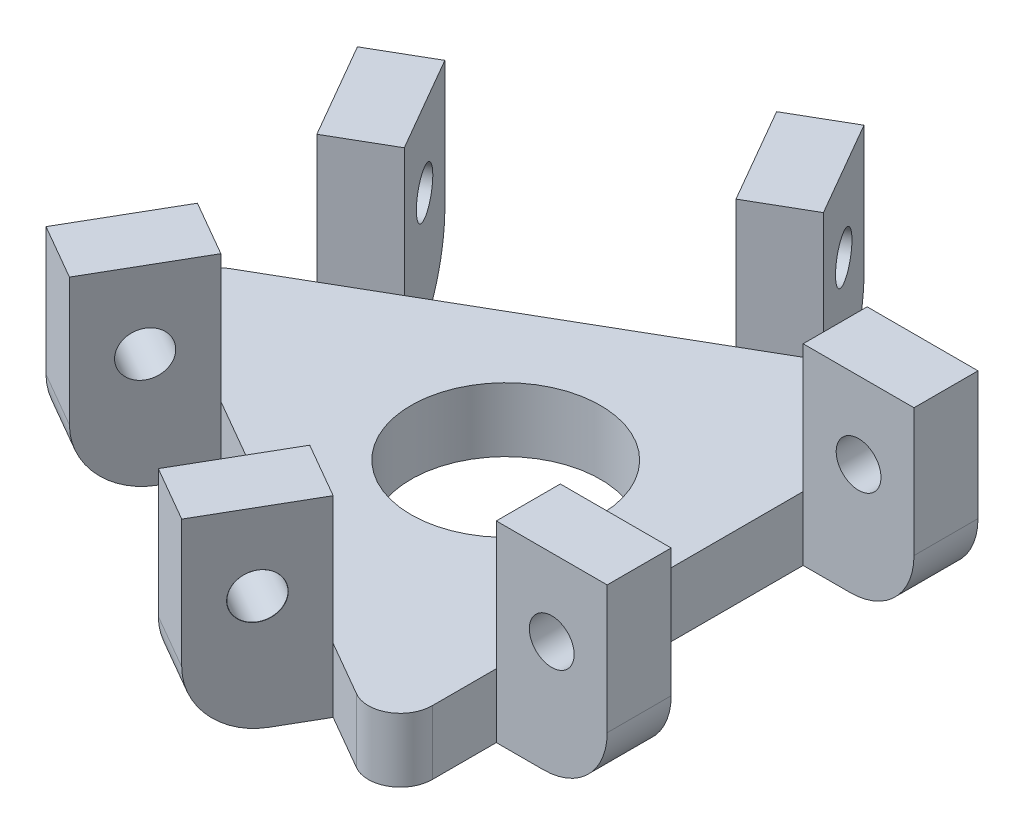
from build123d import *

# Parameters (mm, degrees)
SKETCH2_R                             = 14.798837294
BOSS_EXTRUDE1_DEPTH                   = 10
BOSS_EXTRUDE3_DEPTH                   = 30
FILLET1_R                             = 10
TAP_DRILL_FOR_M8X1_0_TAP1_D           = 7
TAP_DRILL_FOR_M8X1_0_TAP1_CSINK_D     = 7.05
TAP_DRILL_FOR_M8X1_0_TAP1_CSINK_ANGLE = 90
CIRPATTERN1_COUNT                     = 3
FILLET1_OF_CIRPATTERN1_R              = 10


with BuildPart() as part:
    # Sketch2 → Boss-Extrude1 (new body)
    with BuildSketch(Plane(origin=(0, 0, 0), x_dir=(0, 0, -1), z_dir=(0, 1, 0))):
        with BuildLine():
            Line((-38.301270189, -11.339745962), (-43.301270189, -20))
            ThreePointArc((-43.301270189, -20), (-43.301270189, -25), (-38.97114317, -27.5))
            Line((-38.97114317, -27.5), (-28.97114317, -27.5))
            Line((-28.97114317, -27.5), (-18.97114317, -27.5))
            Line((-18.97114317, -27.5), (18.97114317, -27.5))
            Line((18.97114317, -27.5), (28.97114317, -27.5))
            Line((28.97114317, -27.5), (38.97114317, -27.5))
            ThreePointArc((38.97114317, -27.5), (43.301270189, -25), (43.301270189, -20))
            Line((43.301270189, -20), (38.301270189, -11.339745962))
            Line((38.301270189, -11.339745962), (33.301270189, -2.679491924))
            Line((33.301270189, -2.679491924), (14.330127019, 30.179491924))
            Line((14.330127019, 30.179491924), (9.330127019, 38.839745962))
            Line((9.330127019, 38.839745962), (4.330127019, 47.5))
            ThreePointArc((4.330127019, 47.5), (0, 50), (-4.330127019, 47.5))
            Line((-4.330127019, 47.5), (-9.330127019, 38.839745962))
            Line((-9.330127019, 38.839745962), (-14.330127019, 30.179491924))
            Line((-14.330127019, 30.179491924), (-33.301270189, -2.679491924))
            Line((-33.301270189, -2.679491924), (-38.301270189, -11.339745962))
        make_face()
        Circle(SKETCH2_R, mode=Mode.SUBTRACT)
    extrude(amount=BOSS_EXTRUDE1_DEPTH)

    # Sketch2<7> → Boss-Extrude3 (add)
    with BuildSketch(Plane(origin=(0, 0, 0), x_dir=(0, 0, -1), z_dir=(0, 1, 0))):
        Polygon((24.330127019, 47.5), (9.330127019, 38.839745962), (14.330127019, 30.179491924), (29.330127019, 38.839745962), align=None)
        Polygon((33.301270189, -2.679491924), (38.301270189, -11.339745962), (53.301270189, -2.679491924), (48.301270189, 5.980762114), align=None)
    boss_extrude3 = extrude(amount=BOSS_EXTRUDE3_DEPTH)

    # Fillet1
    fillet1_edges = [part.edges().sort_by_distance(p)[0] for p in [
        (-43.169872981, 0, -26.830127019),
        (-1.650635095, 0, -50.801270189),
    ]]
    fillet(fillet1_edges, radius=FILLET1_R)

    # Tap Drill for M8x1.0 Tap1 (through all)
    with Locations(Plane(origin=(-25.089745962, 0, 14.485571585), x_dir=(0.49999999999999517, 0, 0.8660254037844415), z_dir=(-0.8660254037844414, 0, 0.4999999999999951))):
        with Locations((-36.160254038, 18)):
            tap_drill_for_m8x1_0_tap1 = CounterSinkHole(TAP_DRILL_FOR_M8X1_0_TAP1_D / 2, TAP_DRILL_FOR_M8X1_0_TAP1_CSINK_D / 2, counter_sink_angle=TAP_DRILL_FOR_M8X1_0_TAP1_CSINK_ANGLE)

    # CirPattern1: Boss-Extrude3, Tap Drill for M8x1.0 Tap1 ×3 about axis
    cirpattern1_axis = Axis((0, 10, 0), (0, 1, 0))
    add([boss_extrude3.rotate(cirpattern1_axis, i * 360 / CIRPATTERN1_COUNT) for i in range(1, CIRPATTERN1_COUNT)])
    add([tap_drill_for_m8x1_0_tap1.rotate(cirpattern1_axis, i * 360 / CIRPATTERN1_COUNT) for i in range(1, CIRPATTERN1_COUNT)], mode=Mode.SUBTRACT)

    # Fillet1 of CirPattern1
    fillet1_of_cirpattern1_edges = [part.edges().sort_by_distance(p)[0] for p in [
        (-1.650635095, 0, 50.801270189),
        (-43.169872981, 0, 26.830127019),
        (44.820508076, 0, -23.97114317),
        (44.820508076, 0, 23.97114317),
    ]]
    fillet(fillet1_of_cirpattern1_edges, radius=FILLET1_OF_CIRPATTERN1_R)


solid = part.part
